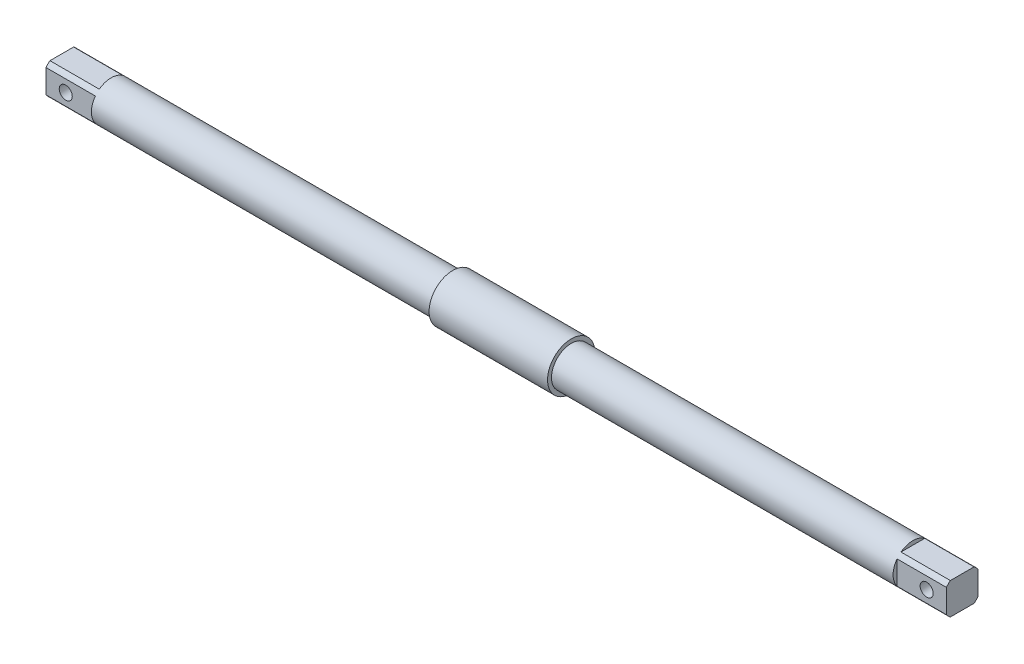
from build123d import *

# Parameters (mm, degrees)
SKETCH_2_OUTSIDE_W   = 59.726
SKETCH_2_OUTSIDE_H   = 59.726
SKETCH_2_OUTSIDE_W_2 = 8
SKETCH_2_OUTSIDE_H_2 = 8
CUT_EXTRUDE_1_DEPTH  = 12.5
HOLE_WIZARD_M4_1_D   = 3.3


with BuildPart() as part:
    # 草图1 → 旋转1 (revolve)
    with BuildSketch(Plane.XY):
        Polygon((114, 0), (114, 5), (15, 5), (15, 6), (-15, 6), (-15, 5), (-114, 5), (-114, 0), align=None)
    revolve(axis=Axis((-114, 0, 0), (1, 0, 0)))

    # 草图2 outside → 切除-拉伸1 (cut)
    with BuildSketch(Plane(origin=(114, 0, 0), x_dir=(0, 0, -1), z_dir=(1, 0, 0))):
        Rectangle(SKETCH_2_OUTSIDE_W, SKETCH_2_OUTSIDE_H)
        Rectangle(SKETCH_2_OUTSIDE_W_2, SKETCH_2_OUTSIDE_H_2, mode=Mode.SUBTRACT)
    cut_extrude_1 = extrude(amount=-CUT_EXTRUDE_1_DEPTH, mode=Mode.SUBTRACT)

    # 镜向2: 切除-拉伸1 across plane
    add(cut_extrude_1.mirror(Plane(origin=(0, 0, 0), x_dir=(0, 0, 1), z_dir=(1, 0, 0))), mode=Mode.SUBTRACT)

    # M4 螺纹孔1 (through all)
    with Locations(Plane.XY.offset(4)):
        with Locations((109, 0), (-109, 0)):
            Hole(HOLE_WIZARD_M4_1_D / 2)


solid = part.part
